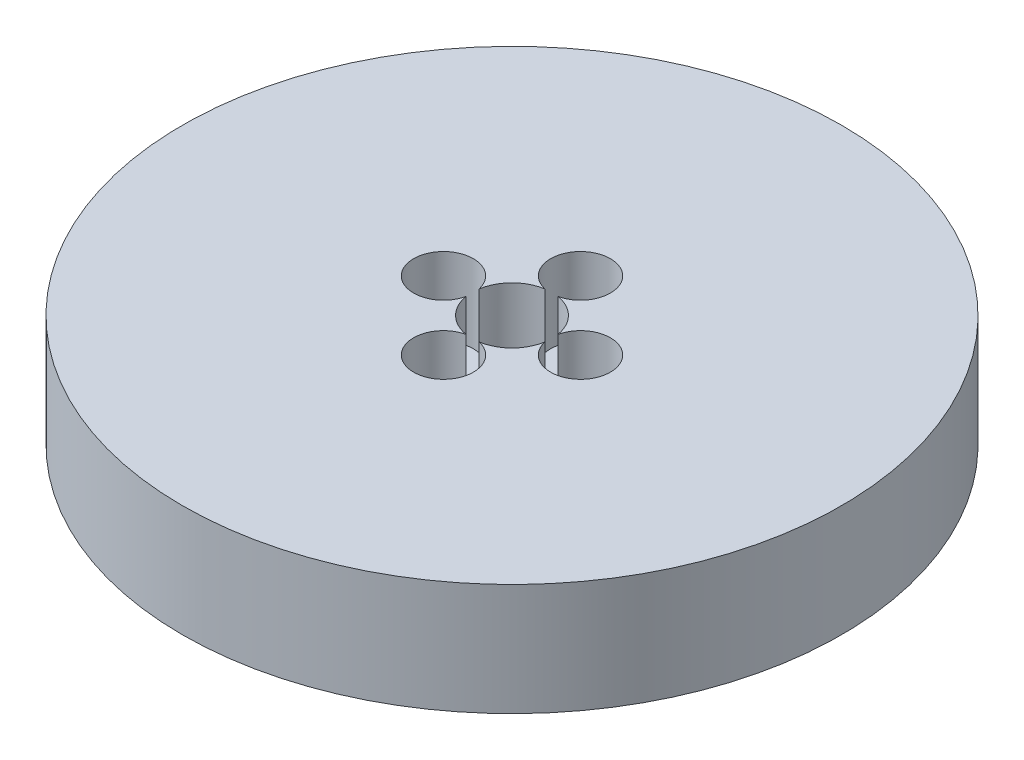
from build123d import *

# Parameters (mm, degrees)
SKETCH1_R           = 82.5
BOSS_EXTRUDE1_DEPTH = 28
SKETCH2_R           = 10
CUT_EXTRUDE1_DEPTH  = 120.98541578
SKETCH3_R           = 7.474835821
CUT_EXTRUDE2_DEPTH  = 19.538330678
CIRPATTERN1_COUNT   = 4


with BuildPart() as part:
    # Sketch1 → Boss-Extrude1 (new body)
    with BuildSketch(Plane(origin=(0, 0, 0), x_dir=(1, 0, 0), z_dir=(0, 1, 0))):
        Circle(SKETCH1_R)
    extrude(amount=BOSS_EXTRUDE1_DEPTH)

    # Sketch2 → Cut-Extrude1 (cut, through all)
    with BuildSketch(Plane(origin=(0, 0, 0), x_dir=(1, 0, 0), z_dir=(0, 1, 0))):
        Circle(SKETCH2_R)
    extrude(amount=CUT_EXTRUDE1_DEPTH, mode=Mode.SUBTRACT)

    # Sketch3 → Cut-Extrude2 (cut)
    with BuildSketch(Plane(origin=(0, 28, 0), x_dir=(1, 0, 0), z_dir=(0, 1, 0))):
        with Locations((-17.151511033, 0)):
            Circle(SKETCH3_R)
    cut_extrude2 = extrude(amount=-CUT_EXTRUDE2_DEPTH, mode=Mode.SUBTRACT)

    # CirPattern1: Cut-Extrude2 ×4 about axis
    cirpattern1_axis = Axis((0, 0, 0), (0, 1, 0))
    for i in range(1, CIRPATTERN1_COUNT):
        add(cut_extrude2.rotate(cirpattern1_axis, i * 360 / CIRPATTERN1_COUNT), mode=Mode.SUBTRACT)


solid = part.part
